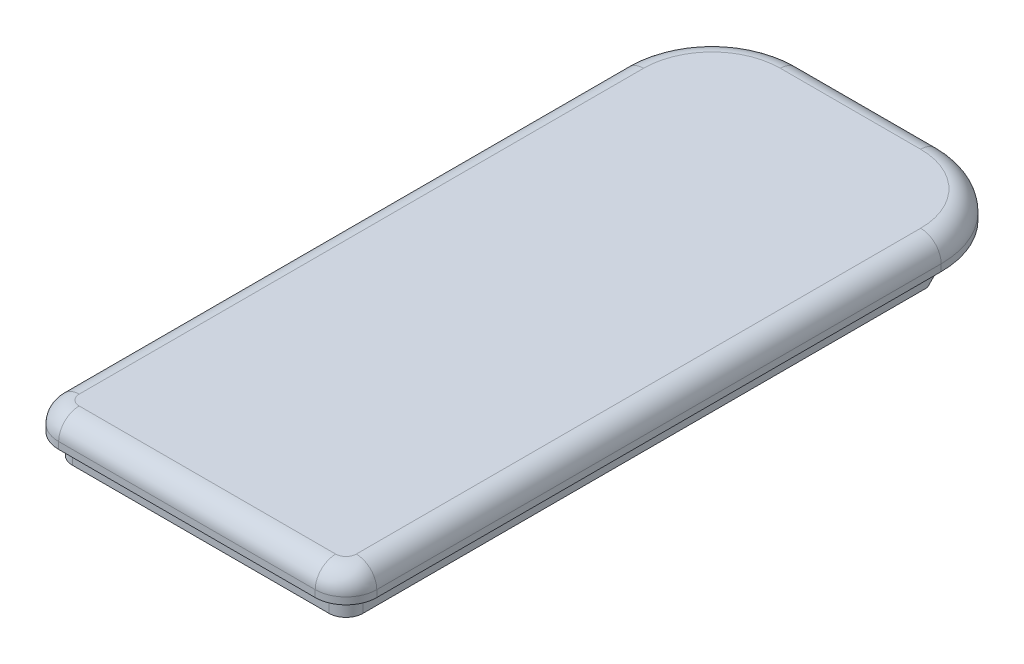
from build123d import *

# Parameters (mm, degrees)
EXTRUDE_1_DEPTH     = 4
CUT_EXTRUDE_1_DEPTH = 1.5
EXTRUDE_START       = 3
EXTRUDE_2_DEPTH     = 3
CHAMFER_1_SIZE      = 3
FILLET_1_R          = 3


with BuildPart() as part:
    # Эскиз1 → Бобышка-Вытянуть1 (new body)
    with BuildSketch(Plane(origin=(0, 0, 0), x_dir=(1, 0, 0), z_dir=(0, 1, 0))):
        with BuildLine():
            Line((4.5, 0), (42, 0))
            ThreePointArc((42, 0), (45.181980515, 1.318019485), (46.5, 4.5))
            Line((46.5, 4.5), (46.5, 87))
            ThreePointArc((46.5, 87), (42.692388155, 96.192388155), (33.5, 100))
            Line((33.5, 100), (13, 100))
            ThreePointArc((13, 100), (3.807611845, 96.192388155), (0, 87))
            Line((0, 87), (0, 4.5))
            ThreePointArc((0, 4.5), (1.318019485, 1.318019485), (4.5, 0))
        make_face()
    extrude(amount=-EXTRUDE_1_DEPTH)

    # Эскиз2 → Вырез-Вытянуть1 (cut)
    with BuildSketch(Plane.XZ.offset(4)):
        with BuildLine():
            Line((3.5, -4.5), (3.5, -87))
            ThreePointArc((3.5, -87), (6.282485579, -93.717514421), (13, -96.5))
            Line((13, -96.5), (33.5, -96.5))
            ThreePointArc((33.5, -96.5), (40.217514421, -93.717514421), (43, -87))
            Line((43, -87), (43, -4.5))
            ThreePointArc((43, -4.5), (42.707106781, -3.792893219), (42, -3.5))
            Line((42, -3.5), (4.5, -3.5))
            ThreePointArc((4.5, -3.5), (3.792893219, -3.792893219), (3.5, -4.5))
        make_face()
    extrude(amount=-CUT_EXTRUDE_1_DEPTH, mode=Mode.SUBTRACT)

    # Эскиз3 → Бобышка-Вытянуть2 (add)
    with BuildSketch(Plane(origin=(0, -4, 0), x_dir=(-1, 0, 0), z_dir=(0, -1, 0)).offset(EXTRUDE_START)):
        with BuildLine():
            Line((-2, 87), (-2, 4.5))
            ThreePointArc((-2, 4.5), (-2.732233047, 2.732233047), (-4.5, 2))
            Line((-4.5, 2), (-42, 2))
            ThreePointArc((-42, 2), (-43.767766953, 2.732233047), (-44.5, 4.5))
            Line((-44.5, 4.5), (-44.5, 87))
            Line((-44.5, 87), (-43, 87))
            Line((-43, 87), (-43, 4.5))
            ThreePointArc((-43, 4.5), (-42.707106781, 3.792893219), (-42, 3.5))
            Line((-42, 3.5), (-4.5, 3.5))
            ThreePointArc((-4.5, 3.5), (-3.792893219, 3.792893219), (-3.5, 4.5))
            Line((-3.5, 4.5), (-3.5, 87))
            Line((-3.5, 87), (-2, 87))
        make_face()
    extrude(amount=-EXTRUDE_2_DEPTH)

    # Фаска1
    # the kernel refuses this chamfer: 3 mm, written as the material it adds along each edge
    with BuildSketch(Plane(origin=(11.215048964, -4, -87), x_dir=(0, 0.027495876610586334, -0.9996219169112968), z_dir=(-1, 0, 0))) as chamfer_1_piece_1_section:
        Polygon((CHAMFER_1_SIZE * 0.999621916911, CHAMFER_1_SIZE * 0.0274958766106), (-CHAMFER_1_SIZE * 0.0274958766106, CHAMFER_1_SIZE * 0.999621916911), (0, 0), align=None)
    chamfer_1_piece_1 = extrude(amount=9.215048964, mode=Mode.PRIVATE)
    chamfer_1_piece_1 = chamfer_1_piece_1 - Plane(origin=(13, -4.5189099, -87), x_dir=(-1, 0, 0), z_dir=(0, -1, 0)) * Cylinder(9.5, 31, mode=Mode.PRIVATE)
    chamfer_1_piece_1 = split(chamfer_1_piece_1, bisect_by=Plane(origin=(3.605353411, -7, -88.883676774), z_dir=(0, 1, 0)), keep=Keep.TOP, mode=Mode.PRIVATE)
    add(chamfer_1_piece_1)
    with BuildSketch(Plane(origin=(44.5, -4, -87), x_dir=(0, 0.027495876610586334, -0.9996219169112968), z_dir=(-1, 0, 0))) as chamfer_1_piece_2_section:
        Polygon((CHAMFER_1_SIZE * 0.999621916911, CHAMFER_1_SIZE * 0.0274958766106), (-CHAMFER_1_SIZE * 0.0274958766106, CHAMFER_1_SIZE * 0.999621916911), (0, 0), align=None)
    chamfer_1_piece_2 = extrude(amount=9.215048964, mode=Mode.PRIVATE)
    chamfer_1_piece_2 = chamfer_1_piece_2 - Plane(origin=(33.5, -4.985903001, -87), x_dir=(0, 0, -1), z_dir=(0, -1, 0)) * Cylinder(9.5, 31, mode=Mode.PRIVATE)
    chamfer_1_piece_2 = split(chamfer_1_piece_2, bisect_by=Plane(origin=(43.75, -7, -87.991212463), z_dir=(0, 1, 0)), keep=Keep.TOP, mode=Mode.PRIVATE)
    add(chamfer_1_piece_2)

    # Скругление1
    fillet_1_edges = [part.edges().sort_by_distance(p)[0] for p in [
        (23.25, 0, 0),
        (1.318019485, 0, -1.318019485),
        (0, 0, -45.75),
        (3.807611845, 0, -96.192388155),
        (23.25, 0, -100),
        (42.692388155, 0, -96.192388155),
        (46.5, 0, -45.75),
        (45.181980515, 0, -1.318019485),
    ]]
    fillet(fillet_1_edges, radius=FILLET_1_R)


solid = part.part
